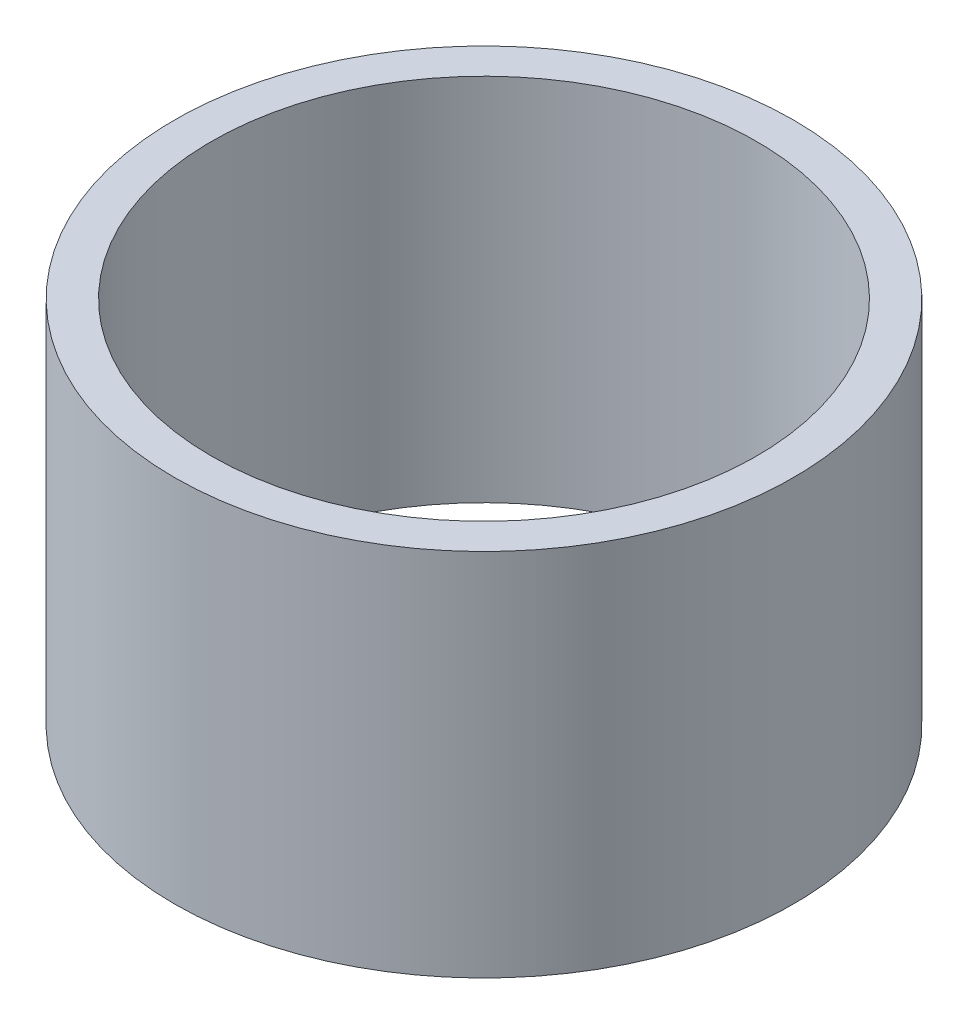
from build123d import *

# Parameters (mm, degrees)
SKETCH1_R           = 55
BOSS_EXTRUDE1_DEPTH = 65.617846403
SKETCH2_R           = 48.425407875
CUT_EXTRUDE1_DEPTH  = 102.762968543


with BuildPart() as part:
    # Sketch1 → Boss-Extrude1 (new body)
    with BuildSketch(Plane(origin=(0, 0, 0), x_dir=(1, 0, 0), z_dir=(0, 1, 0))):
        Circle(SKETCH1_R)
    extrude(amount=BOSS_EXTRUDE1_DEPTH)

    # Sketch2 → Cut-Extrude1 (cut, through all)
    with BuildSketch(Plane(origin=(0, 0, 0), x_dir=(1, 0, 0), z_dir=(0, 1, 0))):
        Circle(SKETCH2_R)
    extrude(amount=CUT_EXTRUDE1_DEPTH, mode=Mode.SUBTRACT)


solid = part.part
